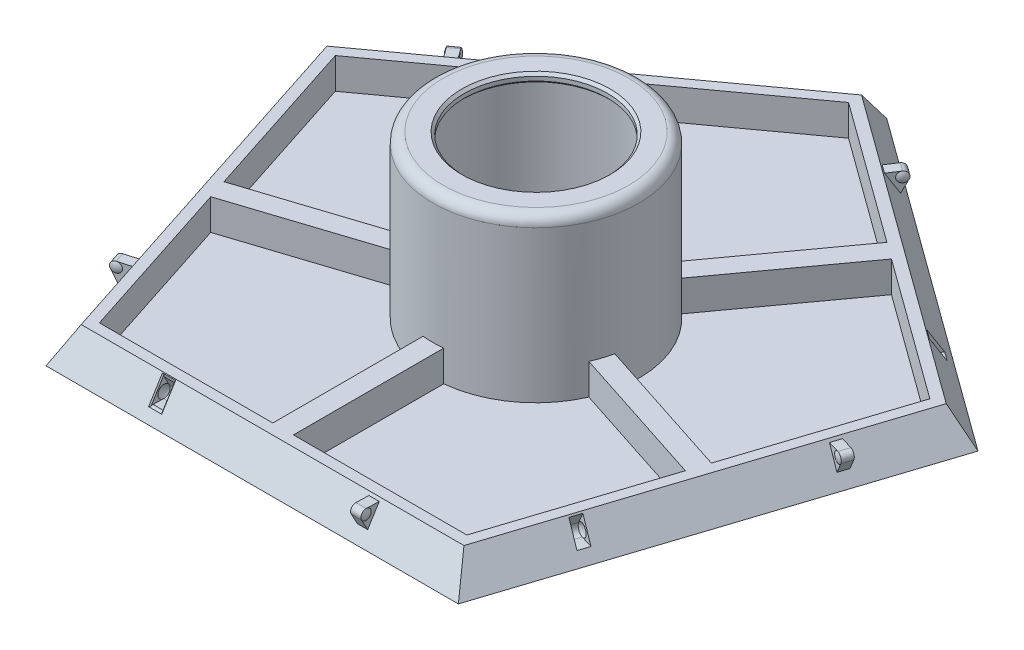
from build123d import *
from OCP.BRepFilletAPI import BRepFilletAPI_MakeChamfer

# Parameters (mm, degrees)
BOSS_EXTRUDE1_DEPTH = 0.4
BOSS_EXTRUDE2_DEPTH = 6
CHAMFER1_SIZE       = 6.4
CHAMFER1_SIZE_2     = 3.955417619
BOSS_EXTRUDE3_DEPTH = 1
CUT_EXTRUDE1_DEPTH  = 1.075
CIRPATTERN1_COUNT   = 5
CHAMFER2_SIZE       = 0.2
CHAMFER2_SIZE2      = 0.546410162
CUT_EXTRUDE2_REACH  = 96.106
SKETCH9_R           = 20
FILLET1_R           = 2
CHAMFER3_SIZE       = 0.5
BOSS_EXTRUDE6_DEPTH = 6
CIRPATTERN4_COUNT   = 5


with BuildPart() as part:
    # Sketch1 → Boss-Extrude1 (new body)
    with BuildSketch(Plane(origin=(0, 0, 0), x_dir=(1, 0, 0), z_dir=(0, 1, 0))):
        Polygon((0, 68.052064668), (-64.72135955, 21.029244485), (-40, -55.055276819), (40, -55.055276819), (64.72135955, 21.029244485), align=None)
    extrude(amount=BOSS_EXTRUDE1_DEPTH)

    # Sketch2 → Boss-Extrude2 (add)
    with BuildSketch(Plane(origin=(0, 0.4, 0), x_dir=(1, 0, 0), z_dir=(0, 1, 0))):
        Polygon((64.72135955, 21.029244485), (0, 68.052064668), (-64.72135955, 21.029244485), (-40, -55.055276819), (40, -55.055276819), align=None)
        Polygon((57.667936522, 18.737448417), (0, 60.635656803), (-57.667936522, 18.737448417), (-35.640744832, -49.055276819), (35.640744832, -49.055276819), align=None, mode=Mode.SUBTRACT)
    extrude(amount=BOSS_EXTRUDE2_DEPTH)

    # Chamfer1
    # the kernel refuses this chamfer: 6.4, 3.955417619 mm, written as the material it takes off along each edge
    with BuildSketch(Plane(origin=(13.387481819, 6.4, -77.778639553), x_dir=(-0.011951463674796303, -0.9997932622810094, -0.0164497785251576), z_dir=(-0.8090169943749475, 0, 0.5877852522924732)), Plane(origin=(34.886436969, 6.4, 70.793205576), x_dir=(0.019337874441129724, -0.9997932622810094, 0.006283256289201955), z_dir=(0.30901699437494756, 0, -0.9510565162951536)), Plane(origin=(-56.547837576, 6.4, 55.055276819), x_dir=(0, -0.9997932622810094, 0.020333044471910092), z_dir=(1, 0, 0)), Plane(origin=(-69.834922581, 6.4, -36.767173242), x_dir=(-0.019337874441129724, -0.9997932622810094, 0.006283256289201957), z_dir=(0.3090169943749477, 0, 0.9510565162951535))) as chamfer1_piece_1:
        Polygon((CHAMFER1_SIZE * 0.999793262281, CHAMFER1_SIZE * 0.0203330444719), (-CHAMFER1_SIZE_2 * 0.0203330444711, CHAMFER1_SIZE_2 * 0.999793262243), (0, 0), align=None)
    extrude(amount=113.095675152, mode=Mode.SUBTRACT)
    with BuildSketch(Plane(origin=(78.108841369, 6.4, -11.3026696), x_dir=(-0.586953868721804, 0.05316829695991145, 0.8078726930593024), z_dir=(-0.8090169943749477, 0, -0.5877852522924728))) as chamfer1_piece_2:
        Polygon((CHAMFER1_SIZE_2 * 0.998585565749, -CHAMFER1_SIZE_2 * 0.0531682969579), (-CHAMFER1_SIZE * 0.0531682969599, -CHAMFER1_SIZE * 0.998585565787), (0, 0), align=None)
    extrude(amount=113.095675152, mode=Mode.SUBTRACT)

    # Sketch3 → Boss-Extrude3 (add, symmetric)
    with BuildSketch(Plane(origin=(20, 0, 0), x_dir=(0, 0, -1), z_dir=(1, 0, 0))):
        with BuildLine():
            Line((-54.842648148, 4.495096909), (-53.648646953, 2.275974881))
            Line((-53.648646953, 2.275974881), (-51.413238488, 5.892941672))
            Line((-51.413238488, 5.892941672), (-53.932055136, 5.968467319))
            ThreePointArc((-53.932055136, 5.968467319), (-54.812677044, 5.494647674), (-54.842648148, 4.495096909))
        make_face()
    boss_extrude3 = extrude(amount=BOSS_EXTRUDE3_DEPTH, both=True)

    # Sketch5 → Revolve1 (revolve)
    with BuildSketch(Plane(origin=(0, 4.968916553, 0), x_dir=(-1, 0, 0), z_dir=(0, 1, 0))):
        with BuildLine():
            Line((-21, 54.962026241), (-21, 53.962026241))
            Line((-21, 53.962026241), (-21.25, 53.962026241))
            ThreePointArc((-21.25, 53.962026241), (-21.186552813, 54.477414444), (-21, 54.962026241))
        make_face()
    revolve1 = revolve(axis=Axis((21, 4.968916553, 53.962026241), (1, 0, 0)))

    # Mirror1: Revolve1 across plane
    add(revolve1.mirror(Plane(origin=(20, 0, 0), x_dir=(0, 0, 1), z_dir=(1, 0, 0))))

    # Sketch6 → Cut-Extrude1 (cut, symmetric)
    with BuildSketch(Plane(origin=(-20, 0, 0), x_dir=(0, 0, -1), z_dir=(1, 0, 0))):
        with BuildLine():
            Line((-51.401250046, 6.292761979), (-50.043112911, 3.768583574))
            ThreePointArc((-50.043112911, 3.768583574), (-50.079078236, 2.569122655), (-51.135824526, 2.000539081))
            Line((-51.135824526, 2.000539081), (-54.000895716, 2.086447023))
            Line((-54.000895716, 2.086447023), (-51.401250046, 6.292761979))
        make_face()
    cut_extrude1 = extrude(amount=CUT_EXTRUDE1_DEPTH, both=True, mode=Mode.SUBTRACT)

    # Sketch8 → Cut-Revolve1 (revolve, cut)
    with BuildSketch(Plane(origin=(0, 3.2, 0), x_dir=(1, 0, 0), z_dir=(0, 1, 0))):
        with BuildLine():
            Line((-21.075, -51.0998592), (-21.475, -51.0998592))
            ThreePointArc((-21.475, -51.0998592), (-21.372366596, -50.467403668), (-21.075, -49.8998592))
            Line((-21.075, -49.8998592), (-21.075, -51.0998592))
        make_face()
    cut_revolve1 = revolve(axis=Axis((-21.075, 3.2, 51.0998592), (-1, 0, 0)), mode=Mode.SUBTRACT)

    # Mirror2: Cut-Revolve1 across plane
    add(cut_revolve1.mirror(Plane(origin=(-20, 0, 0), x_dir=(0, 0, 1), z_dir=(1, 0, 0))), mode=Mode.SUBTRACT)

    # CirPattern1: Boss-Extrude3, Revolve1, Cut-Extrude1, Cut-Revolve1 ×5 about axis
    cirpattern1_axis = Axis((0, 0, 0), (0, 1, 0))
    add([boss_extrude3.rotate(cirpattern1_axis, i * 360 / CIRPATTERN1_COUNT) for i in range(1, CIRPATTERN1_COUNT)])
    add([revolve1.rotate(cirpattern1_axis, i * 360 / CIRPATTERN1_COUNT) for i in range(1, CIRPATTERN1_COUNT)])
    add([cut_extrude1.rotate(cirpattern1_axis, i * 360 / CIRPATTERN1_COUNT) for i in range(1, CIRPATTERN1_COUNT)], mode=Mode.SUBTRACT)
    add([cut_revolve1.rotate(cirpattern1_axis, i * 360 / CIRPATTERN1_COUNT) for i in range(1, CIRPATTERN1_COUNT)], mode=Mode.SUBTRACT)

    # CirPattern1 copy 1 sketch → CirPattern1 copy 1 (revolve)
    with BuildSketch(Plane(origin=(12.360679775, 4.968916553, -38.042260652), x_dir=(0.30901699437494745, 0, -0.9510565162951535), z_dir=(0, 1, 0))):
        with BuildLine():
            Line((-21, -54.962026241), (-21, -53.962026241))
            Line((-21, -53.962026241), (-21.25, -53.962026241))
            ThreePointArc((-21.25, -53.962026241), (-21.186552813, -54.477414444), (-21, -54.962026241))
        make_face()
    revolve(axis=Axis((57.192259582, 4.968916553, -1.39489065), (0.30901699437494745, 0, -0.9510565162951535)))

    # CirPattern1 copy 2 sketch → CirPattern1 copy 2 (revolve)
    with BuildSketch(Plane(origin=(-32.360679775, 4.968916553, -23.511410092), x_dir=(-0.8090169943749473, 0, -0.5877852522924732), z_dir=(0, 1, 0))):
        with BuildLine():
            Line((-21, -54.962026241), (-21, -53.962026241))
            Line((-21, -53.962026241), (-21.25, -53.962026241))
            ThreePointArc((-21.25, -53.962026241), (-21.186552813, -54.477414444), (-21, -54.962026241))
        make_face()
    revolve(axis=Axis((16.346760315, 4.968916553, -54.824116073), (-0.8090169943749473, 0, -0.5877852522924732)))

    # CirPattern1 copy 3 sketch → CirPattern1 copy 3 (revolve)
    with BuildSketch(Plane(origin=(-32.360679775, 4.968916553, 23.511410092), x_dir=(-0.8090169943749476, 0, 0.587785252292473), z_dir=(0, 1, 0))):
        with BuildLine():
            Line((-21, -54.962026241), (-21, -53.962026241))
            Line((-21, -53.962026241), (-21.25, -53.962026241))
            ThreePointArc((-21.25, -53.962026241), (-21.186552813, -54.477414444), (-21, -54.962026241))
        make_face()
    revolve(axis=Axis((-47.089406101, 4.968916553, -32.488276486), (-0.8090169943749476, 0, 0.587785252292473)))

    # CirPattern1 copy 4 sketch → CirPattern1 copy 4 (revolve)
    with BuildSketch(Plane(origin=(12.360679775, 4.968916553, 38.042260652), x_dir=(0.30901699437494723, 0, 0.9510565162951536), z_dir=(0, 1, 0))):
        with BuildLine():
            Line((-21, -54.962026241), (-21, -53.962026241))
            Line((-21, -53.962026241), (-21.25, -53.962026241))
            ThreePointArc((-21.25, -53.962026241), (-21.186552813, -54.477414444), (-21, -54.962026241))
        make_face()
    revolve(axis=Axis((-45.449613795, 4.968916553, 34.745256969), (0.30901699437494723, 0, 0.9510565162951536)))

    # CirPattern1 copy 5 sketch → CirPattern1 copy 5 (revolve, cut)
    with BuildSketch(Plane(origin=(-12.360679775, 3.2, 38.042260652), x_dir=(-0.30901699437494745, 0, 0.9510565162951535), z_dir=(0, 1, 0))):
        with BuildLine():
            Line((-21.075, 51.0998592), (-21.475, 51.0998592))
            ThreePointArc((-21.475, 51.0998592), (-21.372366596, 50.467403668), (-21.075, 49.8998592))
            Line((-21.075, 49.8998592), (-21.075, 51.0998592))
        make_face()
    revolve(axis=Axis((42.750707455, 3.2, 33.789469474), (-0.30901699437494745, 0, 0.9510565162951535)), mode=Mode.SUBTRACT)

    # CirPattern1 copy 6 sketch → CirPattern1 copy 6 (revolve, cut)
    with BuildSketch(Plane(origin=(32.360679775, 3.2, 23.511410092), x_dir=(0.8090169943749473, 0, 0.5877852522924732), z_dir=(0, 1, 0))):
        with BuildLine():
            Line((-21.075, 51.0998592), (-21.475, 51.0998592))
            ThreePointArc((-21.475, 51.0998592), (-21.372366596, 50.467403668), (-21.075, 49.8998592))
            Line((-21.075, 49.8998592), (-21.075, 51.0998592))
        make_face()
    revolve(axis=Axis((45.346390251, 3.2, -30.216818603), (0.8090169943749473, 0, 0.5877852522924732)), mode=Mode.SUBTRACT)

    # CirPattern1 copy 7 sketch → CirPattern1 copy 7 (revolve, cut)
    with BuildSketch(Plane(origin=(32.360679775, 3.2, -23.511410092), x_dir=(0.8090169943749476, 0, -0.587785252292473), z_dir=(0, 1, 0))):
        with BuildLine():
            Line((-21.075, 51.0998592), (-21.475, 51.0998592))
            ThreePointArc((-21.475, 51.0998592), (-21.372366596, 50.467403668), (-21.075, 49.8998592))
            Line((-21.075, 49.8998592), (-21.075, 51.0998592))
        make_face()
    revolve(axis=Axis((-14.725097013, 3.2, -52.464490403), (0.8090169943749476, 0, -0.587785252292473)), mode=Mode.SUBTRACT)

    # CirPattern1 copy 8 sketch → CirPattern1 copy 8 (revolve, cut)
    with BuildSketch(Plane(origin=(-12.360679775, 3.2, -38.042260652), x_dir=(-0.30901699437494723, 0, -0.9510565162951536), z_dir=(0, 1, 0))):
        with BuildLine():
            Line((-21.075, 51.0998592), (-21.475, 51.0998592))
            ThreePointArc((-21.475, 51.0998592), (-21.372366596, 50.467403668), (-21.075, 49.8998592))
            Line((-21.075, 49.8998592), (-21.075, 51.0998592))
        make_face()
    revolve(axis=Axis((-54.447000692, 3.2, -2.208019668), (-0.30901699437494723, 0, -0.9510565162951536)), mode=Mode.SUBTRACT)

    # Chamfer2: one chamfer whose edges measure the first distance from different faces: ONE call of the kernel's chamfer builder (chamfer() names one face for all edges)
    chamfer2_edges_1 = [part.edges().sort_by_distance(p)[0] for p in [
        (-18.925, 4.084458277, 52.53094272),
        (-21.075, 4.084458277, 52.53094272),
    ]]
    chamfer2_edges_2 = [part.edges().sort_by_distance(p)[0] for p in [
        (-20, 2.079525493, 53.770059354),
        (-20, 6.08939106, 51.291826086),
    ]]
    chamfer2_side_2 = [part.faces().sort_by_distance(p)[0] for p in [
        (0.058075129, 3.129583761, 53.121087639),
    ]]
    chamfer2 = BRepFilletAPI_MakeChamfer(part.part.solid().wrapped)
    for e in chamfer2_edges_1:
        chamfer2.Add(CHAMFER2_SIZE, e.wrapped)
    for e in chamfer2_edges_2:
        chamfer2.Add(CHAMFER2_SIZE, CHAMFER2_SIZE2, e.wrapped, chamfer2_side_2[0].wrapped)  # the first distance lies on this face
    add(Compound.cast(chamfer2.Shape()), mode=Mode.REPLACE)

    # Sketch9 → Cut-Extrude2 (cut, up to next)
    with BuildSketch(Plane(origin=(0, 0.4, 0), x_dir=(1, 0, 0), z_dir=(0, 1, 0)), mode=Mode.PRIVATE) as cut_extrude2_sk1:
        with Locations(Location((0, 0, 0), (0, 0, 270))):
            Circle(SKETCH9_R)
    cut_extrude2_tool1 = extrude(cut_extrude2_sk1.sketch, amount=-CUT_EXTRUDE2_REACH, mode=Mode.PRIVATE) & part.part
    add(cut_extrude2_tool1.solids().sort_by_distance((0, 0.4, 0))[0], mode=Mode.SUBTRACT)

    # Sketch13 → Revolve2 (revolve)
    with BuildSketch(Plane(origin=(0, 0, 0), x_dir=(0, 0, -1), z_dir=(1, 0, 0)), mode=Mode.PRIVATE) as revolve2_sk:
        Polygon((-16.5, 0), (-16.5, 30), (-13.9, 30), (-13.9, 31.8), (-20, 31.8), (-20, 0), align=None)
    revolve(revolve2_sk.sketch.rotate(Axis((0, 0, 0), (0, 1, 0)), 180), axis=Axis((0, 0, 0), (0, 1, 0)))

    # Fillet1
    fillet1_edges = [part.edges().sort_by_distance(p)[0] for p in [
        (0, 31.8, 20),
    ]]
    fillet(fillet1_edges, radius=FILLET1_R)

    # Chamfer3
    chamfer3_edges = [part.edges().sort_by_distance(p)[0] for p in [
        (0, 30, 13.9),
        (0, 31.8, 13.9),
    ]]
    chamfer(chamfer3_edges, length=CHAMFER3_SIZE)

    # Sketch14 → Boss-Extrude6 (add)
    with BuildSketch(Plane(origin=(0, 0.4, 0), x_dir=(1, 0, 0), z_dir=(0, 1, 0))):
        with BuildLine():
            Line((-10.078744846, 17.274805421), (-27.215934272, 40.862123115))
            Line((-27.215934272, 40.862123115), (-30.45200225, 38.510982106))
            Line((-30.45200225, 38.510982106), (-13.314812824, 14.923664412))
            ThreePointArc((-13.314812824, 14.923664412), (-11.755705046, 16.180339887), (-10.078744846, 17.274805421))
        make_face()
    boss_extrude6 = extrude(amount=BOSS_EXTRUDE6_DEPTH)

    # CirPattern4: Boss-Extrude6 ×5 about axis
    cirpattern4_axis = Axis((0, 0, 0), (0, 1, 0))
    for i in range(1, CIRPATTERN4_COUNT):
        add(boss_extrude6.rotate(cirpattern4_axis, i * 360 / CIRPATTERN4_COUNT))


solid = part.part
